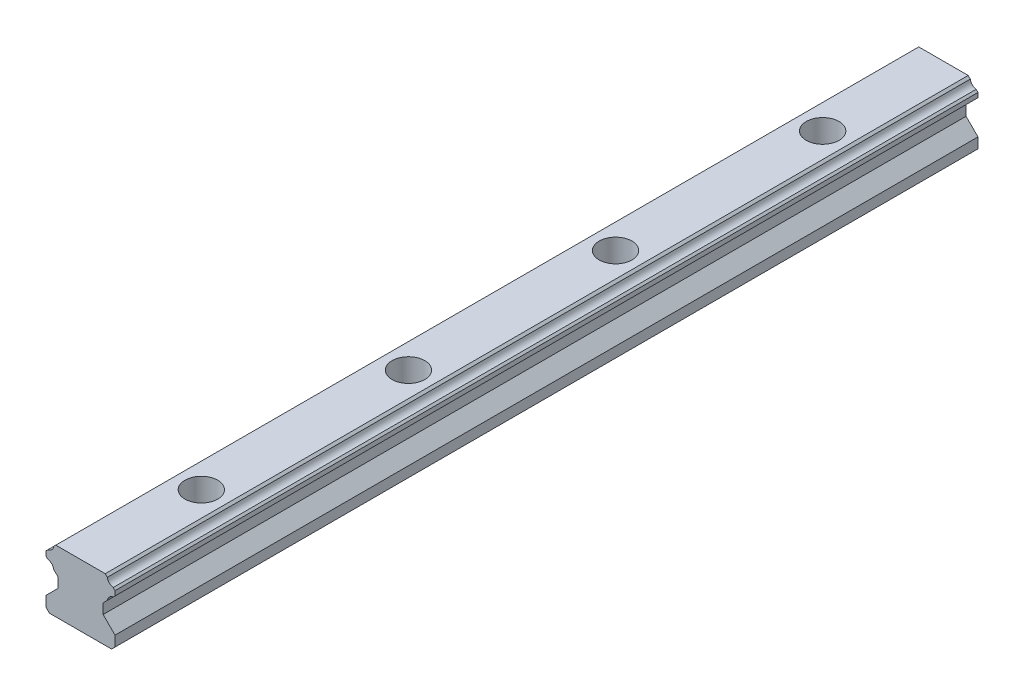
from build123d import *

# Parameters (mm, degrees)
BOSS_EXTRUDE1_DEPTH = 125
SKETCH2_R           = 3
CUT_EXTRUDE1_DEPTH  = 127.684647847
SKETCH3_R           = 4.75
CUT_EXTRUDE2_DEPTH  = 8.5
LPATTERN1_COUNT     = 100
LPATTERN1_PITCH     = 60


with BuildPart() as part:
    # Sketch1 → Boss-Extrude1 (new body)
    with BuildSketch(Plane.XY):
        with BuildLine():
            Line((-6.55, -4.115), (-6.55, -7.045))
            Line((-6.55, -7.045), (-10, -10.495))
            Line((-10, -10.495), (-10, -13.495))
            Line((-10, -13.495), (-9, -14.495))
            Line((-9, -14.495), (0, -14.495))
            Line((0, -14.495), (0, 3.505))
            Line((0, 3.505), (-7.16, 3.505))
            Line((-7.16, 3.505), (-7.768111832, 2.896888168))
            ThreePointArc((-7.768111832, 2.896888168), (-8.334356479, 1.761574733), (-9.469669914, 1.195330086))
            Line((-9.469669914, 1.195330086), (-10, 0.665))
            Line((-10, 0.665), (-10, -0.665))
            Line((-10, -0.665), (-9.469669914, -1.195330086))
            ThreePointArc((-9.469669914, -1.195330086), (-8.334356479, -1.761574733), (-7.768111832, -2.896888168))
            Line((-7.768111832, -2.896888168), (-6.55, -4.115))
        make_face()
    boss_extrude1 = extrude(amount=BOSS_EXTRUDE1_DEPTH)

    # Mirror1: Boss-Extrude1 across plane
    add(boss_extrude1.mirror(Plane(origin=(0, 3.505, 125), x_dir=(0, 0, 1), z_dir=(-1, 0, 0))))

    # Sketch2 → Cut-Extrude1 (cut, through all)
    with BuildSketch(Plane(origin=(0, 3.505, 0), x_dir=(1, 0, 0), z_dir=(0, 1, 0))):
        with Locations((0, -30)):
            Circle(SKETCH2_R)
    cut_extrude1 = extrude(amount=-CUT_EXTRUDE1_DEPTH, mode=Mode.SUBTRACT)

    # Sketch3 → Cut-Extrude2 (cut)
    with BuildSketch(Plane(origin=(0, 3.505, 0), x_dir=(1, 0, 0), z_dir=(0, 1, 0))):
        with Locations((0, -30)):
            Circle(SKETCH3_R)
    cut_extrude2 = extrude(amount=-CUT_EXTRUDE2_DEPTH, mode=Mode.SUBTRACT)

    # LPattern1: Cut-Extrude1, Cut-Extrude2 ×100
    with Locations(*[(0, 0, i * LPATTERN1_PITCH) for i in range(1, LPATTERN1_COUNT)]):
        add(cut_extrude1, mode=Mode.SUBTRACT)
        add(cut_extrude2, mode=Mode.SUBTRACT)

    # Mirror2: part across plane


with BuildPart() as part_1:
    add(part.part)
    add(part.part.mirror(Plane(origin=(-9.748570041, -3.175788295, 0), x_dir=(1, 0, 0), z_dir=(0, 0, -1))))


solid = part_1.part
